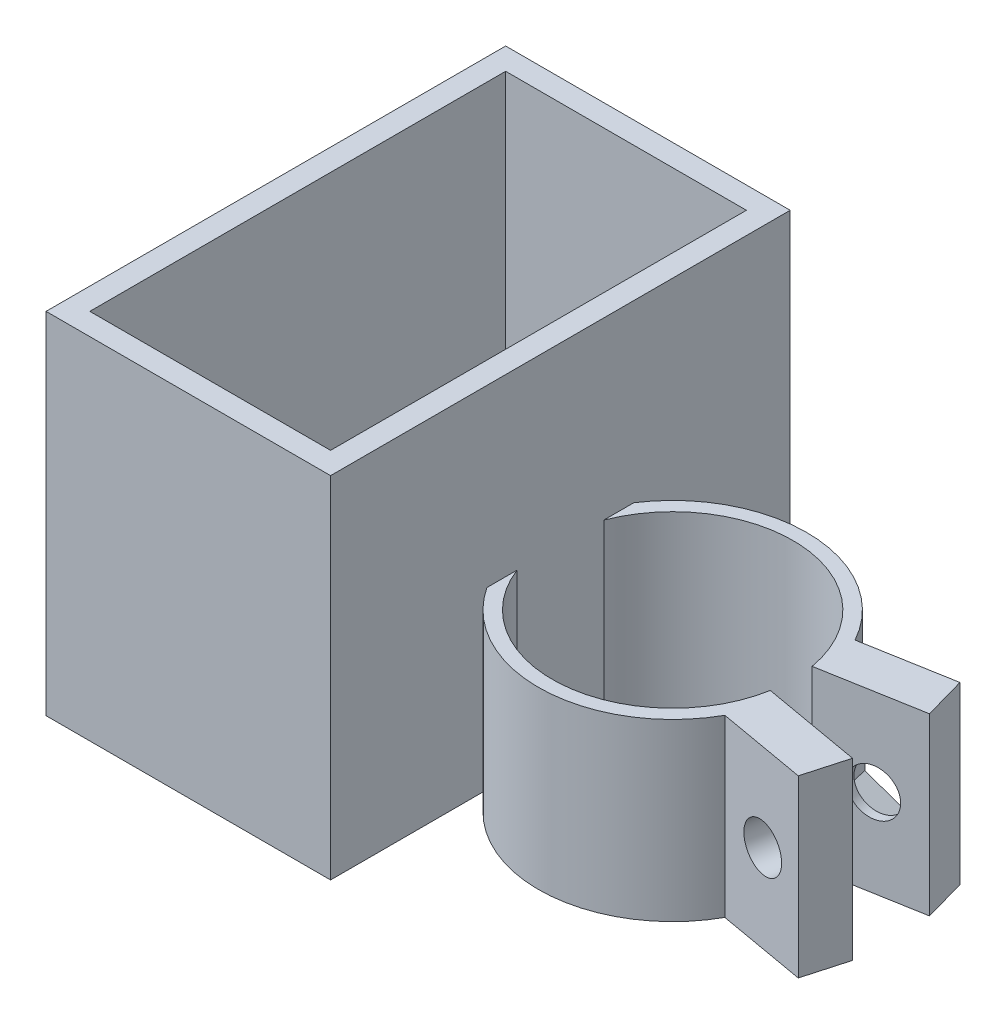
from build123d import *

# Parameters (mm, degrees)
BOSS_EXTRUDE1_DEPTH = 25.4
CUT_EXTRUDE1_REACH  = 50.793
SKETCH3_R           = 3.3734375
CUT_EXTRUDE2_REACH  = 50.793
SKETCH4_R           = 3.3734375
SKETCH6_W           = 41.275
SKETCH6_H           = 66.675
SKETCH6_W_2         = 34.925
SKETCH6_H_2         = 60.325
BOSS_EXTRUDE4_DEPTH = 50.8
CUT_EXTRUDE3_DEPTH  = 5.08
CUT_EXTRUDE3_DRAFT  = -4.3
SKETCH9_W           = 34.925
SKETCH9_H           = 60.325
BOSS_EXTRUDE6_DEPTH = 3.175


with BuildPart() as part:
    # Sketch1 → Boss-Extrude1 (new body)
    with BuildSketch(Plane(origin=(0, 0, 0), x_dir=(1, 0, 0), z_dir=(0, 1, 0))):
        with BuildLine():
            ThreePointArc((17.015291884, 9.448214029), (-19.4625, 0), (17.015291884, -9.448214029))
            Line((17.015291884, -9.448214029), (29.947744788, -11.728554403))
            Line((29.947744788, -11.728554403), (31.673879356, -5.584959514))
            Line((31.673879356, -5.584959514), (17.197205387, -3.032331303))
            ThreePointArc((17.197205387, -3.032331303), (-17.4625, 0), (17.197205387, 3.032331303))
            Line((17.197205387, 3.032331303), (31.673879356, 5.584959514))
            Line((31.673879356, 5.584959514), (29.947744788, 11.728554403))
            Line((29.947744788, 11.728554403), (17.015291884, 9.448214029))
        make_face()
    extrude(amount=BOSS_EXTRUDE1_DEPTH)

    # Sketch3 → Cut-Extrude1 (cut, up to next)
    with BuildSketch(Plane(origin=(-1.102665928, 0, 6.253529232), x_dir=(0.984807753012208, 0, 0.17364817766693044), z_dir=(-0.17364817766693044, 0, 0.984807753012208)), mode=Mode.PRIVATE) as cut_extrude1_sk1:
        with Locations((25.179413351, 12.7)):
            Circle(SKETCH3_R)
    cut_extrude1_tool1 = extrude(cut_extrude1_sk1.sketch, amount=-CUT_EXTRUDE1_REACH, mode=Mode.PRIVATE) & part.part
    add(cut_extrude1_tool1.solids().sort_by_distance((23.694216, 12.7, 10.625888))[0], mode=Mode.SUBTRACT)

    # Sketch4 → Cut-Extrude2 (cut, up to next)
    with BuildSketch(Plane(origin=(-1.102665928, 0, -6.253529232), x_dir=(-0.984807753012208, 0, 0.17364817766693136), z_dir=(-0.17364817766693136, 0, -0.984807753012208)), mode=Mode.PRIVATE) as cut_extrude2_sk1:
        with Locations((-25.179413351, 12.7)):
            Circle(SKETCH4_R)
    cut_extrude2_tool1 = extrude(cut_extrude2_sk1.sketch, amount=-CUT_EXTRUDE2_REACH, mode=Mode.PRIVATE) & part.part
    add(cut_extrude2_tool1.solids().sort_by_distance((23.694216, 12.7, -10.625888))[0], mode=Mode.SUBTRACT)

    # Sketch6 → Boss-Extrude4 (add)
    with BuildSketch(Plane.XZ):
        with Locations((-36.925, 0)):
            Rectangle(SKETCH6_W, SKETCH6_H)
        with Locations((-36.925, 0)):
            Rectangle(SKETCH6_W_2, SKETCH6_H_2, mode=Mode.SUBTRACT)
    extrude(amount=-BOSS_EXTRUDE4_DEPTH)


with BuildPart() as cut_extrude3_tool:
    # Sketch8 → Cut-Extrude3 (with draft: the straight prism first)
    with BuildSketch(Plane(origin=(-1.102665928, 0, -6.253529232), x_dir=(-0.984807753012208, 0, 0.17364817766693136), z_dir=(-0.17364817766693136, 0, -0.984807753012208))):
        Polygon((-19.616813351, 9.488431393), (-19.616813351, 15.911568607), (-25.179413351, 19.123137215), (-30.742013351, 15.911568607), (-30.742013351, 9.488431393), (-25.179413351, 6.276862785), align=None)
    extrude(amount=-CUT_EXTRUDE3_DEPTH)
    # Cut-Extrude3: the draft: its side faces are tilted about the plane it starts from
    cut_extrude3_sides = [cut_extrude3_tool.faces().sort_by_distance(p)[0] for p in [
        (18.65719032, 12.7, -7.158541429),
        (21.396236124, 17.517352911, -7.641509106),
        (26.874327731, 17.517352911, -8.607444459),
        (29.613373534, 12.7, -9.090412135),
        (26.874327731, 7.882647089, -8.607444459),
        (21.396236124, 7.882647089, -7.641509106),
    ]]
    draft(cut_extrude3_sides, Plane(origin=(-1.102665928, 0, -6.253529232), x_dir=(-0.984807753012208, 0, 0.17364817766693136), z_dir=(-0.17364817766693136, 0, -0.984807753012208)), CUT_EXTRUDE3_DRAFT)


with BuildPart() as part_1:
    add(part.part)

    # Cut-Extrude3: cut by cut_extrude3_tool
    add(cut_extrude3_tool.part, mode=Mode.SUBTRACT)

    # Sketch9 → Boss-Extrude6 (add)
    with BuildSketch(Plane.XZ):
        with Locations((-36.925, 0)):
            Rectangle(SKETCH9_W, SKETCH9_H)
    extrude(amount=-BOSS_EXTRUDE6_DEPTH)


solid = part_1.part
